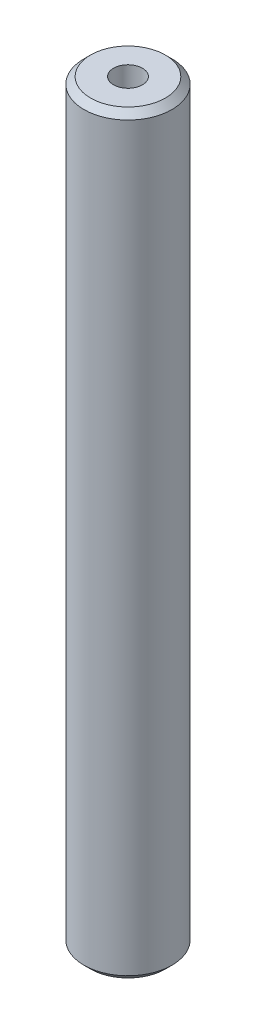
from build123d import *

# Parameters (mm, degrees)
SKETCH1_R           = 35
BOSS_EXTRUDE1_DEPTH = 600
SKETCH2_R           = 11.488949854
CUT_EXTRUDE1_DEPTH  = 603.038204768
CHAMFER1_SIZE       = 5.272411586


with BuildPart() as part:
    # Sketch1 → Boss-Extrude1 (new body)
    with BuildSketch(Plane(origin=(0, 0, 0), x_dir=(1, 0, 0), z_dir=(0, 1, 0))):
        Circle(SKETCH1_R)
    extrude(amount=BOSS_EXTRUDE1_DEPTH)

    # Sketch2 → Cut-Extrude1 (cut, through all)
    with BuildSketch(Plane(origin=(0, 0, 0), x_dir=(1, 0, 0), z_dir=(0, 1, 0))):
        Circle(SKETCH2_R)
    extrude(amount=CUT_EXTRUDE1_DEPTH, mode=Mode.SUBTRACT)

    # Chamfer1
    chamfer1_edges = [part.edges().sort_by_distance(p)[0] for p in [
        (-35, 600, 0),
        (-35, 0, 0),
    ]]
    chamfer(chamfer1_edges, length=CHAMFER1_SIZE)


solid = part.part
